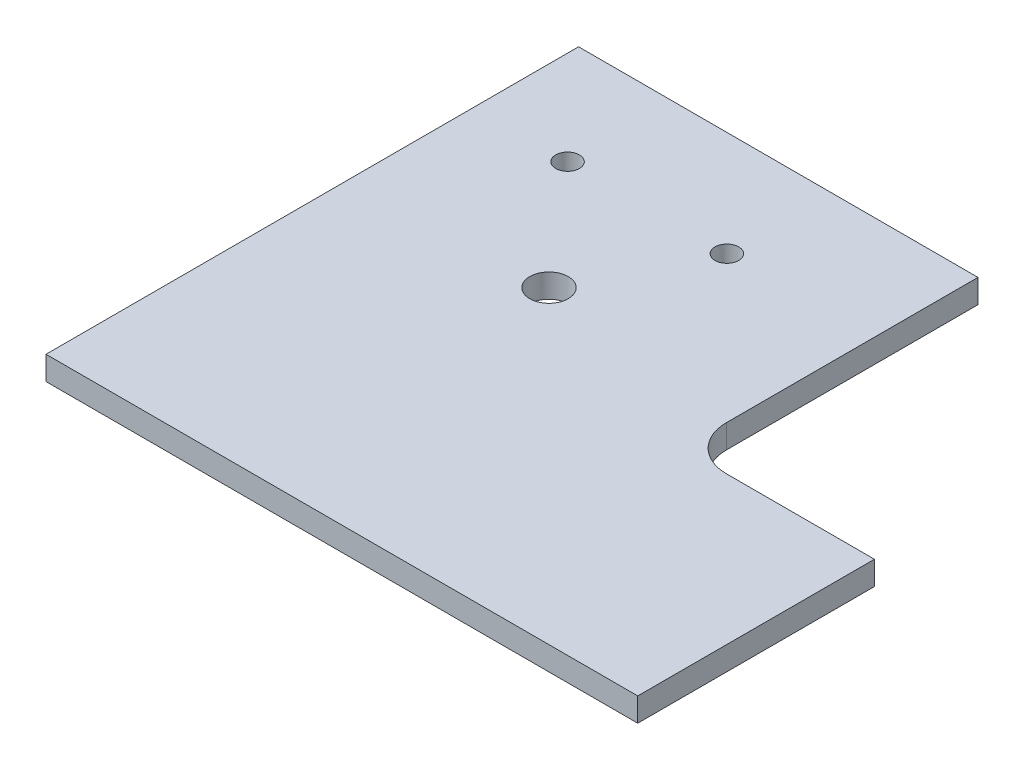
from build123d import *

# Parameters (mm, degrees)
BOSS_EXTRUDE1_DEPTH     = 1.6
FILLET1_R               = 3
M2_CLEARANCE_HOLE1_D    = 2.6
CUT_EXTRUDE1_DEPTH      = 38.159251876
CUT_EXTRUDE1_DEPTH_BACK = 38.159251876
SKETCH5_R               = 0.8
SKETCH6_R               = 3
CUT_EXTRUDE2_DEPTH      = 0.001


with BuildPart() as part:
    # Sketch1 → Boss-Extrude1 (new body)
    with BuildSketch(Plane(origin=(0, 0, 0), x_dir=(1, 0, 0), z_dir=(0, 1, 0))):
        Polygon((-13.5, -10), (-13.5, 10), (13.5, 10), (13.5, -10), (26.5, -10), (26.5, -26), (-13.5, -26), align=None)
    extrude(amount=BOSS_EXTRUDE1_DEPTH)

    # Fillet1
    fillet1_edges = [part.edges().sort_by_distance(p)[0] for p in [
        (13.5, 0.8, 10),
    ]]
    fillet(fillet1_edges, radius=FILLET1_R)

    # M2 Clearance Hole1 (through all)
    with Locations(Plane(origin=(0, 1.6, 0), x_dir=(1, 0, 0), z_dir=(0, 1, 0))):
        with Locations((-0.4, -5.1)):
            Hole(M2_CLEARANCE_HOLE1_D / 2)

    # Sketch5 → Cut-Extrude1 (cut, two sides: drawn at the far end of the back side and taken through both)
    with BuildSketch(Plane(origin=(0, 1.6, 0), x_dir=(1, 0, 0), z_dir=(0, 1, 0)).offset(-CUT_EXTRUDE1_DEPTH_BACK)):
        with Locations((-7.145, 2.9)):
            Circle(SKETCH5_R)
        with Locations((3.625, 2.9)):
            Circle(SKETCH5_R)
    extrude(amount=CUT_EXTRUDE1_DEPTH + CUT_EXTRUDE1_DEPTH_BACK, mode=Mode.SUBTRACT)

    # Sketch6 → Cut-Extrude2 (cut)
    with BuildSketch(Plane.XZ):
        with Locations((-0.4, 5.1)):
            Circle(SKETCH6_R)
    extrude(amount=-CUT_EXTRUDE2_DEPTH, mode=Mode.SUBTRACT)


solid = part.part
